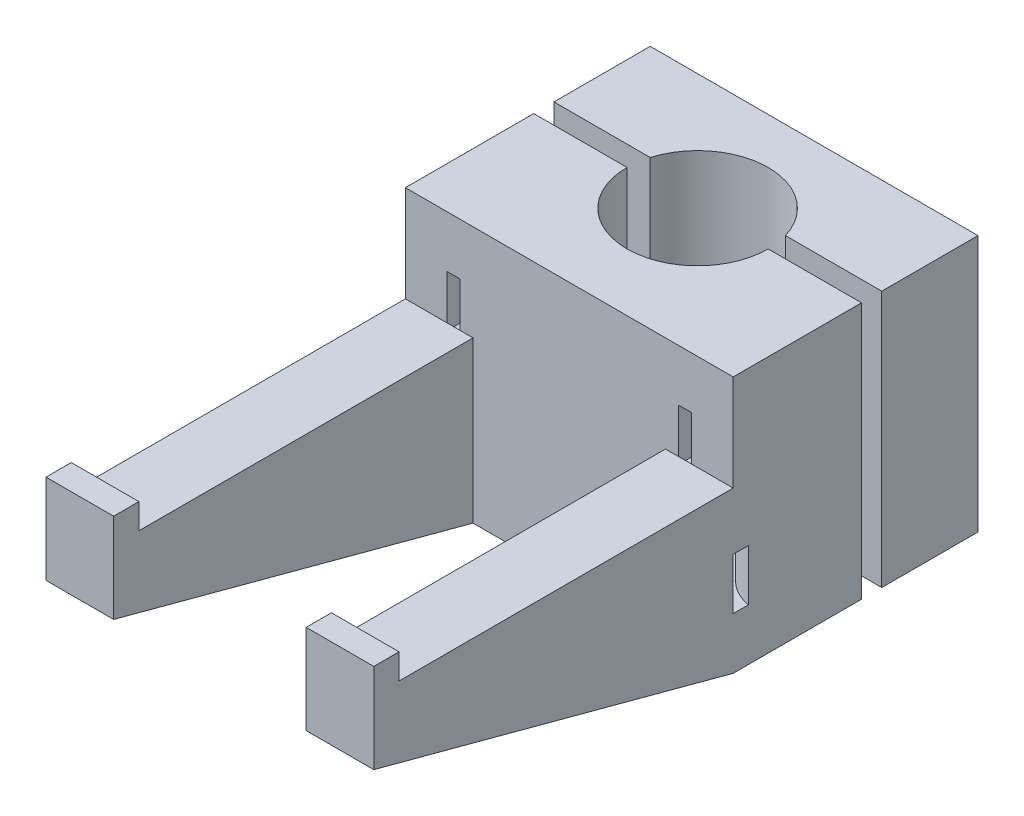
from build123d import *

# Parameters (mm, degrees)
BOSS_EXTRUDE1_DEPTH = 50.8
BOSS_EXTRUDE3_DEPTH = 50.8
SKETCH1_4_W         = 13.385099925
SKETCH1_4_H         = 71.12
BOSS_EXTRUDE2_DEPTH = 50.8
CUT_EXTRUDE1_START  = -32.435099925
CUT_EXTRUDE1_DEPTH  = 64.87019985
SKETCH3_R           = 3.937
SKETCH3_R_2         = 3.3782
CUT_EXTRUDE2_DEPTH  = 8.255
SKETCH3_2_W         = 2.54
SKETCH3_2_H         = 10.16
CUT_EXTRUDE3_DEPTH  = 25.4
CUT_EXTRUDE6_START  = -32.4351
SKETCH2_6_W         = 3
SKETCH2_6_H         = 10.16
CUT_EXTRUDE6_DEPTH  = 8.235
CUT_EXTRUDE7_START  = 21.6601
CUT_EXTRUDE7_DEPTH  = 10.775
FILLET2_R           = 10
SKETCH3_5_R         = 3.3782
SKETCH3_5_W         = 2.54
SKETCH3_5_H         = 10.16
CUT_EXTRUDE8_DEPTH  = 28.255


with BuildPart() as part:
    # Sketch1 → Boss-Extrude1 (new body)
    with BuildSketch(Plane(origin=(0, 0, 0), x_dir=(1, 0, 0), z_dir=(0, 1, 0))):
        with BuildLine():
            ThreePointArc((13.97, 0), (0, -13.97), (-13.97, 0))
            Line((-13.97, 0), (-32.435099925, 0))
            Line((-32.435099925, 0), (-32.435099925, -25.4))
            Line((-32.435099925, -25.4), (-19.05, -25.4))
            Line((-19.05, -25.4), (19.05, -25.4))
            Line((19.05, -25.4), (32.435099925, -25.4))
            Line((32.435099925, -25.4), (32.435099925, 0))
            Line((32.435099925, 0), (13.97, 0))
        make_face()
    extrude(amount=BOSS_EXTRUDE1_DEPTH)

    # Sketch1<4> → Boss-Extrude2 (add)
    with BuildSketch(Plane(origin=(0, 0, 0), x_dir=(1, 0, 0), z_dir=(0, 1, 0))):
        with Locations((-25.742549963, -60.96)):
            Rectangle(SKETCH1_4_W, SKETCH1_4_H)
        with Locations((25.742549963, -60.96)):
            Rectangle(SKETCH1_4_W, SKETCH1_4_H)
    extrude(amount=BOSS_EXTRUDE2_DEPTH)

    # Cut-Extrude1: read off the stored shape, not the designer's step
    # Cut-Extrude1 outline → Cut-Extrude1 (cut)
    with BuildSketch(Plane(origin=(0, 0, 0), x_dir=(0, 0, -1), z_dir=(1, 0, 0)).offset(CUT_EXTRUDE1_START)):
        Polygon((-96.52, 0), (-25.4, 0), (-96.52, 19.05), align=None)
        Polygon((-91.52, 31.75), (-25.4, 31.75), (-25.4, 50.8), (-96.52, 50.8), (-96.52, 36.75), (-91.52, 36.75), align=None)
    extrude(amount=CUT_EXTRUDE1_DEPTH, mode=Mode.SUBTRACT)

    # Sketch3 → Cut-Extrude2 (cut)
    # profile 1 of 4: a face of its own
    with BuildSketch(Plane.XY):
        with Locations((-22.930099925, 25.4)):
            Circle(SKETCH3_R)
        with Locations((-22.930099925, 25.4)):
            Circle(SKETCH3_R_2, mode=Mode.SUBTRACT)
    # profile 2 of 4: a face of its own
    with BuildSketch(Plane.XY):
        with Locations((-22.930099925, 25.4)):
            Circle(SKETCH3_R_2)
    # profile 3 of 4: a face of its own
    with BuildSketch(Plane.XY):
        with Locations((22.930099925, 25.4)):
            Circle(SKETCH3_R)
        with Locations((22.930099925, 25.4)):
            Circle(SKETCH3_R_2, mode=Mode.SUBTRACT)
    # profile 4 of 4: a face of its own
    with BuildSketch(Plane.XY):
        with Locations((22.930099925, 25.4)):
            Circle(SKETCH3_R_2)
    extrude(amount=CUT_EXTRUDE2_DEPTH, mode=Mode.SUBTRACT)

    # Sketch3<2> → Cut-Extrude3 (cut)
    with BuildSketch(Plane.XY):
        with Locations((22.930099925, 35.48)):
            Rectangle(SKETCH3_2_W, SKETCH3_2_H)
        with Locations((-22.930099925, 35.48)):
            Rectangle(SKETCH3_2_W, SKETCH3_2_H)
        with Locations((22.930099925, 15.32)):
            Rectangle(SKETCH3_2_W, SKETCH3_2_H)
        with Locations((-22.930099925, 15.32)):
            Rectangle(SKETCH3_2_W, SKETCH3_2_H)
    extrude(amount=CUT_EXTRUDE3_DEPTH, mode=Mode.SUBTRACT)

    # Sketch2<6> → Cut-Extrude6 (cut)
    with BuildSketch(Plane(origin=(0, 0, 0), x_dir=(0, 0, -1), z_dir=(1, 0, 0)).offset(CUT_EXTRUDE6_START)):
        Polygon((-96.52, 19.05), (-96.52, 0), (-25.4, 0), align=None)
        with Locations((-23.9, 15.32)):
            Rectangle(SKETCH2_6_W, SKETCH2_6_H)
    extrude(amount=CUT_EXTRUDE6_DEPTH, mode=Mode.SUBTRACT)

    # Sketch2<7> → Cut-Extrude7 (cut)
    with BuildSketch(Plane(origin=(0, 0, 0), x_dir=(0, 0, -1), z_dir=(1, 0, 0)).offset(CUT_EXTRUDE7_START)):
        Polygon((-22.4, 20.4), (-25.4, 20.4), (-25.4, 19.05), (-25.4, 10.24), (-22.4, 10.24), align=None)
    extrude(amount=CUT_EXTRUDE7_DEPTH, mode=Mode.SUBTRACT)

    # Fillet2
    # the kernel refuses this fillet: 10 mm, written as the material it takes off along each edge
    with BuildSketch(Plane(origin=(24.200099925, 20.4, 22.4), x_dir=(0, 0, -1), z_dir=(0, -1, 0))) as fillet2_piece_1:
        with BuildLine():
            CenterArc((9.843006414, 10), FILLET2_R, 190.165960228, 79.834039772)
            Line((0, 8.235000075), (0, 0))
            Line((0, 0), (9.843006414, 0))
        make_face()
    extrude(amount=10.16, mode=Mode.SUBTRACT)
    # the kernel refuses this fillet: 10 mm, written as the material it takes off along each edge
    with BuildSketch(Plane(origin=(-24.2001, 20.4, 22.4), x_dir=(7.62810550624482e-09, 0, -1.0), z_dir=(0, -1, 0))) as fillet2_2_piece_1:
        with BuildLine():
            CenterArc((9.843006338, -10), FILLET2_R, 89.999999563, 79.834039772)
            Line((-6.3e-08, -8.235), (0, 0))
            Line((0, 0), (9.843006414, 0))
        make_face()
    extrude(amount=10.16, mode=Mode.SUBTRACT)
    # the kernel refuses this fillet: 10 mm, written as the material it adds along each edge
    with BuildSketch(Plane(origin=(21.660099925, 10.24, 25.4), x_dir=(1, 0, 0), z_dir=(0, 1, 0))) as fillet2_3_piece_1_section:
        with BuildLine():
            CenterArc((FILLET2_R, FILLET2_R), FILLET2_R, 180, 90)
            Line((0, FILLET2_R), (0, 0))
            Line((0, 0), (FILLET2_R, 0))
        make_face()
    fillet2_3_piece_1 = extrude(amount=35.16, mode=Mode.PRIVATE)
    fillet2_3_piece_1 = split(fillet2_3_piece_1, bisect_by=Plane(origin=(21.660099925, 30.4, 25.4), z_dir=(0, -1, 0)), keep=Keep.TOP, mode=Mode.PRIVATE)
    add(fillet2_3_piece_1)
    # the kernel refuses this fillet: 10 mm, written as the material it adds along each edge
    with BuildSketch(Plane(origin=(-21.660099925, 45.4, 25.4), x_dir=(0, 0, -1), z_dir=(0, -1, 0))) as fillet2_4_piece_1_section:
        with BuildLine():
            CenterArc((FILLET2_R, -FILLET2_R), FILLET2_R, 90, 90)
            Line((0, -FILLET2_R), (0, 0))
            Line((0, 0), (FILLET2_R, 0))
        make_face()
    fillet2_4_piece_1 = extrude(amount=60.16, mode=Mode.PRIVATE)
    fillet2_4_piece_1 = split(fillet2_4_piece_1, bisect_by=Plane(origin=(-21.660099925, 30.4, 25.4), z_dir=(0, -1, 0)), keep=Keep.TOP, mode=Mode.PRIVATE)
    fillet2_4_piece_1 = split(fillet2_4_piece_1, bisect_by=Plane(origin=(-21.660099925, 0, 25.4), z_dir=(0, 1, 0)), keep=Keep.TOP, mode=Mode.PRIVATE)
    add(fillet2_4_piece_1)


with BuildPart() as body_2:
    # Sketch1<5> → Boss-Extrude3 (new body)
    with BuildSketch(Plane(origin=(0, 0, 0), x_dir=(1, 0, 0), z_dir=(0, 1, 0))):
        with BuildLine():
            Line((-32.435099925, 4), (-13.385099925, 4))
            ThreePointArc((-13.385099925, 4), (0, 13.97), (13.385099925, 4))
            Line((13.385099925, 4), (32.435099925, 4))
            Line((32.435099925, 4), (32.435099925, 23.05))
            Line((32.435099925, 23.05), (-32.435099925, 23.05))
            Line((-32.435099925, 23.05), (-32.435099925, 4))
        make_face()
    extrude(amount=BOSS_EXTRUDE3_DEPTH)

    # Sketch3<5> → Cut-Extrude8 (cut)
    with BuildSketch(Plane.XY):
        with Locations(Location((22.930099925, 25.4, 0), (0, 0, 180))):
            Circle(SKETCH3_5_R)
        with Locations((22.930099925, 35.48)):
            Rectangle(SKETCH3_5_W, SKETCH3_5_H)
        with Locations((22.930099925, 15.32)):
            Rectangle(SKETCH3_5_W, SKETCH3_5_H)
        with Locations((-22.930099925, 35.48)):
            Rectangle(SKETCH3_5_W, SKETCH3_5_H)
        with Locations(Location((-22.930099925, 25.4, 0), (0, 0, 180))):
            Circle(SKETCH3_5_R)
        with Locations((-22.930099925, 15.32)):
            Rectangle(SKETCH3_5_W, SKETCH3_5_H)
    extrude(amount=-CUT_EXTRUDE8_DEPTH, mode=Mode.SUBTRACT)


solid = Compound([part.part, body_2.part])
